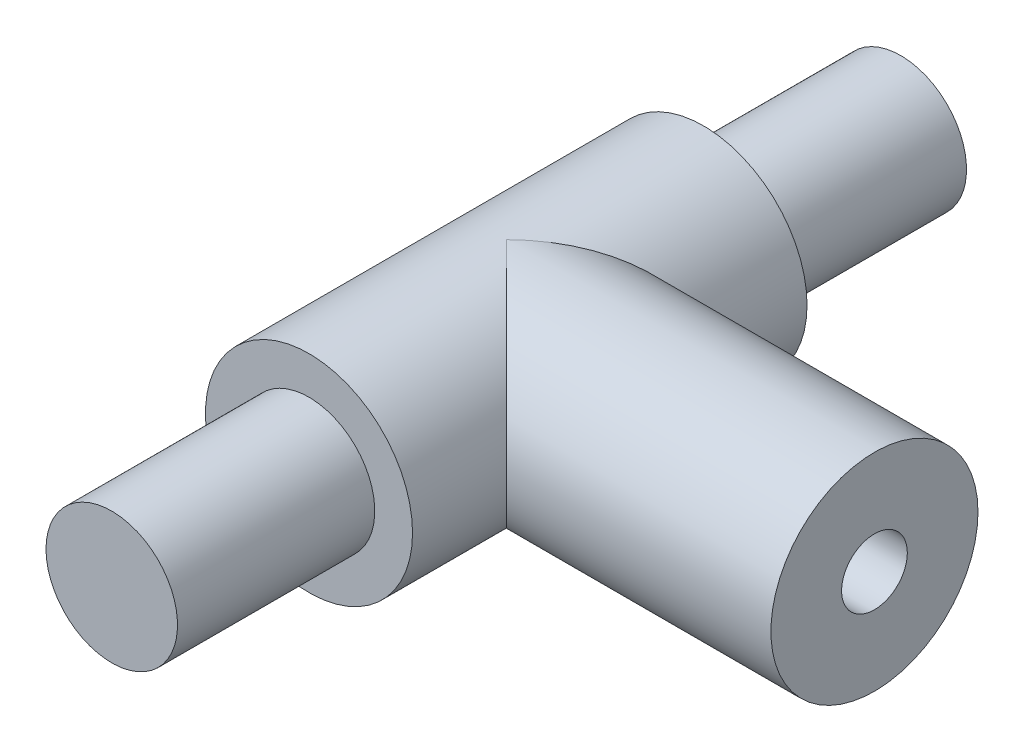
from build123d import *

# Parameters (mm, degrees)
SKETCH1_R           = 5
BOSS_EXTRUDE1_DEPTH = 9.525
SKETCH5_R           = 3.175
BOSS_EXTRUDE4_DEPTH = 19.05
SKETCH6_R           = 5
BOSS_EXTRUDE5_DEPTH = 17.78
SKETCH7_R           = 1.5875
CUT_EXTRUDE1_DEPTH  = 12.7


with BuildPart() as part:
    # Sketch1 → Boss-Extrude1 (new, symmetric)
    with BuildSketch(Plane.XY):
        Circle(SKETCH1_R)
    extrude(amount=BOSS_EXTRUDE1_DEPTH, both=True)

    # Sketch5 → Boss-Extrude4 (add, symmetric)
    with BuildSketch(Plane.XY):
        Circle(SKETCH5_R)
    extrude(amount=BOSS_EXTRUDE4_DEPTH, both=True)

    # Sketch6 → Boss-Extrude5 (add)
    with BuildSketch(Plane(origin=(0, 0, 0), x_dir=(0, 0, -1), z_dir=(1, 0, 0))):
        Circle(SKETCH6_R)
    extrude(amount=BOSS_EXTRUDE5_DEPTH)

    # Sketch7 → Cut-Extrude1 (cut)
    with BuildSketch(Plane(origin=(17.78, 0, 0), x_dir=(0, 0, -1), z_dir=(1, 0, 0))):
        Circle(SKETCH7_R)
    extrude(amount=-CUT_EXTRUDE1_DEPTH, mode=Mode.SUBTRACT)


solid = part.part
